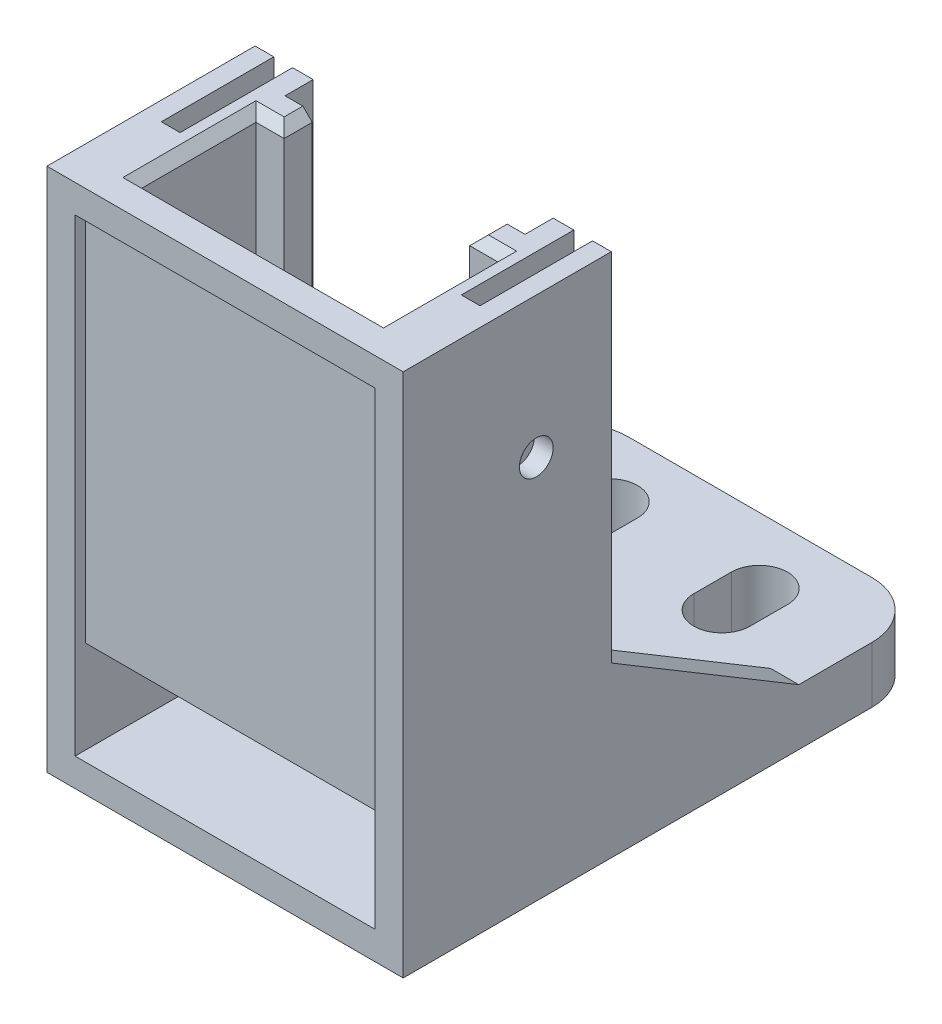
from build123d import *

# Parameters (mm, degrees)
EXTRUDE_1_DEPTH     = 25
SKETCH_2_W          = 19
SKETCH_2_H          = 28
EXTRUDE_2_DEPTH     = 3
SKETCH_3_W          = 1
SKETCH_3_H          = 6
CUT_EXTRUDE_1_DEPTH = 15
CUT_EXTRUDE_START   = -19
SKETCH_4_R          = 0.9
CUT_EXTRUDE_2_DEPTH = 19
FILLET_1_R          = 3
EXTRUDE_3_DEPTH     = 1.5
EXTRUDE_4_DEPTH     = 5
CHAMFER_1_SIZE      = 0.5
SHELL_START         = -8
SHELL_1_DEPTH       = 16
SHELL_1_2_DEPTH     = 0.05
SHELL_START_2       = 7.95
SHELL_1_3_DEPTH     = 0.05
CUT_EXTRUDE_3_DEPTH = 1.5
SKETCH_8_W          = 12.8
SKETCH_8_H          = 20
CUT_EXTRUDE_4_DEPTH = 1.5


# Read off the part's stored shape, not the designer's step: 抽壳1
with BuildPart() as part:
    # 草图1 → 凸台-拉伸1 (new body)
    with BuildSketch(Plane(origin=(0, 0, 0), x_dir=(1, 0, 0), z_dir=(0, 1, 0))):
        Polygon((-9.5, 11.1), (-9.5, 0), (9.5, 0), (9.5, 11.1), (4.95, 11.1), (4.95, 8.1), (6.45, 8.1), (6.45, 2), (-6.45, 2), (-6.45, 8.1), (-4.95, 8.1), (-4.95, 11.1), align=None)
    extrude(amount=EXTRUDE_1_DEPTH)

    # 草图2 → 凸台-拉伸2 (add)
    with BuildSketch(Plane.XZ):
        with Locations((0, -14)):
            Rectangle(SKETCH_2_W, SKETCH_2_H)
        with BuildLine():
            Line((-2.5, -22.5), (-2.5, -24.5))
            ThreePointArc((-2.5, -24.5), (-4, -26), (-5.5, -24.5))
            Line((-5.5, -24.5), (-5.5, -22.5))
            ThreePointArc((-5.5, -22.5), (-4, -21), (-2.5, -22.5))
        make_face(mode=Mode.SUBTRACT)
        with BuildLine():
            Line((2.5, -24.5), (2.5, -22.5))
            ThreePointArc((2.5, -22.5), (4, -21), (5.5, -22.5))
            Line((5.5, -22.5), (5.5, -24.5))
            ThreePointArc((5.5, -24.5), (4, -26), (2.5, -24.5))
        make_face(mode=Mode.SUBTRACT)
    extrude(amount=EXTRUDE_2_DEPTH)

    # 草图3 → 切除-拉伸1 (cut)
    with BuildSketch(Plane(origin=(0, 25, 0), x_dir=(1, 0, 0), z_dir=(0, 1, 0))):
        with Locations((-8, 8.1)):
            Rectangle(SKETCH_3_W, SKETCH_3_H)
        with Locations((8, 8.1)):
            Rectangle(SKETCH_3_W, SKETCH_3_H)
    extrude(amount=-CUT_EXTRUDE_1_DEPTH, mode=Mode.SUBTRACT)

    # 草图4 → 切除-拉伸2 (cut)
    with BuildSketch(Plane.ZY.offset(9.5).offset(CUT_EXTRUDE_START)):
        with Locations((-7.1, 17.5)):
            Circle(SKETCH_4_R)
    extrude(amount=CUT_EXTRUDE_2_DEPTH, mode=Mode.SUBTRACT)

    # 圆角1
    fillet_1_edges = [part.edges().sort_by_distance(p)[0] for p in [
        (9.5, -1.5, -28),
        (-9.5, -1.5, -28),
    ]]
    fillet(fillet_1_edges, radius=FILLET_1_R)

    # 草图5 → 凸台-拉伸3 (add)
    with BuildSketch(Plane.ZY.offset(9.5)):
        Polygon((-11.1, 0), (-11.1, 6), (-21.1, 0), align=None)
    extrude_3 = extrude(amount=-EXTRUDE_3_DEPTH)

    # 镜向1: 凸台-拉伸3 across plane
    add(extrude_3.mirror(Plane(origin=(0, 0, 0), x_dir=(0, 0, 1), z_dir=(1, 0, 0))))

    # 草图6 → 凸台-拉伸4 (add)
    with BuildSketch(Plane(origin=(0, 0, 0), x_dir=(1, 0, 0), z_dir=(0, 1, 0))):
        Polygon((-6.45, 2), (6.45, 2), (6.45, 8.1), (4.95, 8.1), (4.95, 11.1), (-4.95, 11.1), (-4.95, 8.1), (-6.45, 8.1), align=None)
    extrude(amount=EXTRUDE_4_DEPTH)

    # 倒角1
    chamfer_1_edges = [part.edges().sort_by_distance(p)[0] for p in [
        (4.95, 25, -9.6),
        (5.7, 25, -8.1),
        (6.45, 25, -5.05),
        (0, 25, -2),
        (-6.45, 25, -5.05),
        (-5.7, 25, -8.1),
        (-4.95, 25, -9.6),
    ]]
    chamfer(chamfer_1_edges, length=CHAMFER_1_SIZE)

    # 抽壳1 outline → 抽壳1 (cut)
    with BuildSketch(Plane.YZ.offset(SHELL_START)):
        Polygon((3.5, -0.5), (23.5, -0.5), (23.5, 0), (-1.5, 0), (-1.5, -9.6), (3.5, -9.6), align=None)
    extrude(amount=SHELL_1_DEPTH, mode=Mode.SUBTRACT)

    # Shell 1 2 outline → Shell 1 2 (cut)
    with BuildSketch(Plane.YZ.offset(SHELL_START)):
        Polygon((8.5, -3.6), (23.5, -3.6), (23.5, -0.5), (3.5, -0.5), (3.5, -9.6), (8.5, -9.6), align=None)
    extrude(amount=SHELL_1_2_DEPTH, mode=Mode.SUBTRACT)

    # Shell 1 3 outline → Shell 1 3 (cut)
    with BuildSketch(Plane.YZ.offset(SHELL_START_2)):
        Polygon((8.5, -3.6), (23.5, -3.6), (23.5, -0.5), (3.5, -0.5), (3.5, -9.6), (8.5, -9.6), align=None)
    extrude(amount=SHELL_1_3_DEPTH, mode=Mode.SUBTRACT)

    # 草图7 → 切除-拉伸3 (cut)
    with BuildSketch(Plane.XZ.offset(3)):
        with BuildLine():
            Line((8, -11.1), (-8, -11.1))
            Line((-8, -11.1), (-8, -25))
            ThreePointArc((-8, -25), (-7.560660172, -26.060660172), (-6.5, -26.5))
            Line((-6.5, -26.5), (-6.236067977, -26.5))
            ThreePointArc((-6.236067977, -26.5), (-6.802517077, -25.570466269), (-7, -24.5))
            Line((-7, -24.5), (-7, -22.5))
            ThreePointArc((-7, -22.5), (-4, -19.5), (-1, -22.5))
            Line((-1, -22.5), (-1, -24.5))
            ThreePointArc((-1, -24.5), (-1.197482923, -25.570466269), (-1.763932023, -26.5))
            Line((-1.763932023, -26.5), (1.763932023, -26.5))
            ThreePointArc((1.763932023, -26.5), (1.197482923, -25.570466269), (1, -24.5))
            Line((1, -24.5), (1, -22.5))
            ThreePointArc((1, -22.5), (4, -19.5), (7, -22.5))
            Line((7, -22.5), (7, -24.5))
            ThreePointArc((7, -24.5), (6.802517077, -25.570466269), (6.236067977, -26.5))
            Line((6.236067977, -26.5), (6.5, -26.5))
            ThreePointArc((6.5, -26.5), (7.560660172, -26.060660172), (8, -25))
            Line((8, -25), (8, -11.1))
        make_face()
    extrude(amount=-CUT_EXTRUDE_3_DEPTH, mode=Mode.SUBTRACT)

    # 草图8 → 切除-拉伸4 (cut)
    with BuildSketch(Plane(origin=(0, 0, -11.1), x_dir=(-1, 0, 0), z_dir=(0, 0, -1))):
        with Locations((0, 15)):
            Rectangle(SKETCH_8_W, SKETCH_8_H)
    extrude(amount=-CUT_EXTRUDE_4_DEPTH, mode=Mode.SUBTRACT)


solid = part.part
